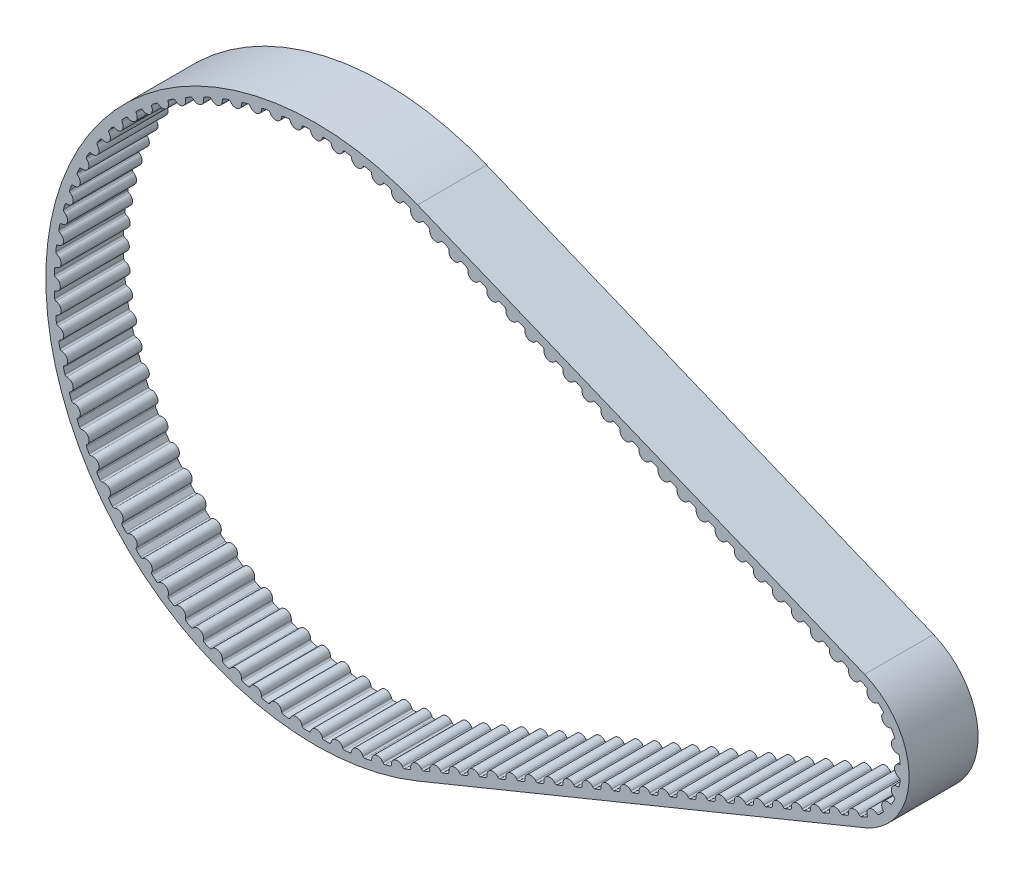
from build123d import *

# Parameters (mm, degrees)
BOSS_EXTRUDE1_DEPTH = 5
BOSS_EXTRUDE2_DEPTH = 10
CRVPATTERN1_START   = -5
CRVPATTERN1_DEPTH   = 10


# Read off the part's stored shape, not the designer's step: CrvPattern1
with BuildPart() as part:
    # Sketch1 → Boss-Extrude1 (new, symmetric)
    with BuildSketch(Plane.XY):
        with BuildLine():
            Line((14.796175155, 36.134164839), (79.540334051, 9.622803097))
            ThreePointArc((79.540334051, 9.622803097), (85.998296586, 0), (79.540334051, -9.622803097))
            Line((79.540334051, -9.622803097), (14.796175155, -36.134164839))
            ThreePointArc((14.796175155, -36.134164839), (-39.046186342, 0), (14.796175155, 36.134164839))
        make_face()
        with BuildLine():
            Line((14.330078536, 34.995896882), (79.074237432, 8.48453514))
            ThreePointArc((79.074237432, 8.48453514), (84.768296586, 0), (79.074237432, -8.48453514))
            Line((79.074237432, -8.48453514), (14.330078536, -34.995896882))
            ThreePointArc((14.330078536, -34.995896882), (-37.816186342, 0), (14.330078536, 34.995896882))
        make_face(mode=Mode.SUBTRACT)
    extrude(amount=BOSS_EXTRUDE1_DEPTH, both=True)

    # Sketch2 → Boss-Extrude2 (add)
    with BuildSketch(Plane.XY.offset(5)):
        with BuildLine():
            Line((-37.800086465, -1.103364278), (-38.300086465, -1.103364278))
            Line((-38.300086465, -1.103364278), (-38.300086465, 1.103364278))
            Line((-38.300086465, 1.103364278), (-37.800086465, 1.103364278))
            ThreePointArc((-37.800086465, 1.103364278), (-37.747580991, 0.938960056), (-37.603699093, 0.84365228))
            ThreePointArc((-37.603699093, 0.84365228), (-36.946186342, 0), (-37.603699093, -0.84365228))
            ThreePointArc((-37.603699093, -0.84365228), (-37.747580991, -0.938960056), (-37.800086465, -1.103364278))
        make_face()
    extrude(amount=-BOSS_EXTRUDE2_DEPTH)

    # CrvPattern1 outline → CrvPattern1 (add)
    with BuildSketch(Plane.XY.offset(CRVPATTERN1_START)):
        with BuildLine():
            ThreePointArc((-37.420700285, 3.800148005), (-37.556636037, 3.90648259), (-37.596041386, 4.074508753))
            ThreePointArc((-37.596041386, 4.074508753), (-37.698917327, 2.975832969), (-37.769693365, 1.874623321))
            ThreePointArc((-37.769693365, 1.874623321), (-37.704413408, 2.034385958), (-37.553477728, 2.118075822))
            ThreePointArc((-37.553477728, 2.118075822), (-36.83161522, 2.907370892), (-37.420700285, 3.800148005))
        make_face()
        with BuildLine():
            ThreePointArc((-37.005616272, 6.733075006), (-37.132762798, 6.849776907), (-37.158823627, 7.020382904))
            ThreePointArc((-37.158823627, 7.020382904), (-37.347837589, 5.933209661), (-37.505050586, 4.840984405))
            ThreePointArc((-37.505050586, 4.840984405), (-37.427401016, 4.995114601), (-37.270347665, 5.066667503))
            ThreePointArc((-37.270347665, 5.066667503), (-36.48861243, 5.796710112), (-37.005616272, 6.733075006))
        make_face()
        with BuildLine():
            ThreePointArc((-36.361021427, 9.624243113), (-36.478590157, 9.750588538), (-36.491144836, 9.92271626))
            ThreePointArc((-36.491144836, 9.92271626), (-36.765124545, 8.853788267), (-37.007799457, 7.777321443))
            ThreePointArc((-37.007799457, 7.777321443), (-36.91826186, 7.924863273), (-36.756064892, 7.983835439))
            ThreePointArc((-36.756064892, 7.983835439), (-35.919305295, 8.650097823), (-36.361021427, 9.624243113))
        make_face()
        with BuildLine():
            ThreePointArc((-35.490913562, 12.455721144), (-35.598175329, 12.590926492), (-35.597145994, 12.763508395))
            ThreePointArc((-35.597145994, 12.763508395), (-35.954392212, 11.719455199), (-36.281023956, 10.665423112))
            ThreePointArc((-36.281023956, 10.665423112), (-36.18015365, 10.805461515), (-36.013819019, 10.851487196))
            ThreePointArc((-36.013819019, 10.851487196), (-35.127224687, 11.449837159), (-35.490913562, 12.455721144))
        make_face()
        with BuildLine():
            ThreePointArc((-34.400689134, 15.209948119), (-34.496978694, 15.353174839), (-34.482371729, 15.525140561))
            ThreePointArc((-34.482371729, 15.525140561), (-34.920668796, 14.512437437), (-35.329231585, 13.487377251))
            ThreePointArc((-35.329231585, 13.487377251), (-35.217654172, 13.6190437), (-35.048213494, 13.651837443))
            ThreePointArc((-35.048213494, 13.651837443), (-34.117283134, 14.178563987), (-34.400689134, 15.209948119))
        make_face()
        with BuildLine():
            ThreePointArc((-33.097109773, 17.869842174), (-33.181829934, 18.020201967), (-33.153735931, 18.190484966))
            ThreePointArc((-33.153735931, 18.190484966), (-33.670365505, 17.215412754), (-34.15832541, 16.225681948))
            ThreePointArc((-34.15832541, 16.225681948), (-34.036732899, 16.348159841), (-33.865237055, 16.367518256))
            ThreePointArc((-33.865237055, 16.367518256), (-32.895744348, 16.819354596), (-33.097109773, 17.869842174))
        make_face()
        with BuildLine():
            ThreePointArc((-31.588260349, 20.418906503), (-31.660885671, 20.575466828), (-31.619478871, 20.743011001))
            ThreePointArc((-31.619478871, 20.743011001), (-32.211236787, 19.81161715), (-32.775567455, 18.863354088))
            ThreePointArc((-32.775567455, 18.863354088), (-32.644713971, 18.975883812), (-32.472226587, 18.981686837))
            ThreePointArc((-32.472226587, 18.981686837), (-31.470184378, 19.355830658), (-31.588260349, 20.418906503))
        make_face()
        with BuildLine():
            ThreePointArc((-29.883498828, 22.84133167), (-29.943578885, 23.003121532), (-29.889116095, 23.16688776))
            ThreePointArc((-29.889116095, 23.16688776), (-30.552332239, 22.284948827), (-31.18953366, 21.384034688))
            ThreePointArc((-31.18953366, 21.384034688), (-31.050230762, 21.485918325), (-30.877821614, 21.47812997))
            ThreePointArc((-30.877821614, 21.47812997), (-29.849444624, 21.772260813), (-29.883498828, 22.84133167))
        make_face()
        with BuildLine():
            ThreePointArc((-27.993398233, 25.122093664), (-28.040560405, 25.288109634), (-27.973379406, 25.44708223))
            ThreePointArc((-27.973379406, 25.44708223), (-28.703940476, 24.620068047), (-29.410060692, 23.772090349))
            ThreePointArc((-29.410060692, 23.772090349), (-29.263172345, 23.862696012), (-29.091910724, 23.841364581))
            ThreePointArc((-29.091910724, 23.841364581), (-28.043577001, 24.053658229), (-27.993398233, 25.122093664))
        make_face()
        with BuildLine():
            ThreePointArc((-25.929681069, 27.247047076), (-25.963632854, 27.416259514), (-25.884150307, 27.569452521))
            ThreePointArc((-25.884150307, 27.569452521), (-26.677525323, 26.802492274), (-27.448184939, 26.012710221))
            ThreePointArc((-27.448184939, 26.012710221), (-27.294622152, 26.09147597), (-27.125570231, 26.056733761))
            ThreePointArc((-27.125570231, 26.056733761), (-26.063781599, 26.185873558), (-25.929681069, 27.247047076))
        make_face()
        with BuildLine():
            ThreePointArc((-23.705146622, 29.203012829), (-23.725677449, 29.37437227), (-23.634386309, 29.520835578))
            ThreePointArc((-23.634386309, 29.520835578), (-24.485654717, 28.818685997), (-25.31607406, 28.091997858))
            ThreePointArc((-25.31607406, 28.091997858), (-25.156789237, 28.158435183), (-24.990995487, 28.11049767))
            ThreePointArc((-24.990995487, 28.11049767), (-23.922337215, 28.155682684), (-23.705146622, 29.203012829))
        make_face()
        with BuildLine():
            ThreePointArc((-21.333591575, 30.97785992), (-21.34057411, 31.150303583), (-21.23804057, 31.289128818))
            ThreePointArc((-21.23804057, 31.289128818), (-22.141922756, 30.656144671), (-23.026951521, 29.997057407))
            ThreePointArc((-23.026951521, 29.997057407), (-22.862932557, 30.05075426), (-22.701425238, 29.989918754))
            ThreePointArc((-22.701425238, 29.989918754), (-21.632525203, 29.950868745), (-21.333591575, 30.97785992))
        make_face()
        with BuildLine():
            ThreePointArc((-18.82972444, 32.560580649), (-18.823115379, 32.73303903), (-18.709975356, 32.86336519))
            ThreePointArc((-18.709975356, 32.86336519), (-19.660865395, 32.303472281), (-20.595014585, 31.716073586))
            ThreePointArc((-20.595014585, 31.716073586), (-20.427278733, 31.756696936), (-20.271059523, 31.683340741))
            ThreePointArc((-20.271059523, 31.683340741), (-19.208547101, 31.560297899), (-18.82972444, 32.560580649))
        make_face()
        with BuildLine():
            ThreePointArc((-16.209074337, 33.941358898), (-16.188914668, 34.1127624), (-16.065869864, 34.233781196))
            ThreePointArc((-16.065869864, 34.233781196), (-17.057870284, 33.750452009), (-18.035346256, 33.238384962))
            ThreePointArc((-18.035346256, 33.238384962), (-17.864933822, 33.265682861), (-17.714971601, 33.180260937))
            ThreePointArc((-17.714971601, 33.180260937), (-16.665436551, 32.973988381), (-16.209074337, 33.941358898))
        make_face()
        with BuildLine():
            ThreePointArc((-13.487894679, 35.111631005), (-13.454309434, 35.280916574), (-13.322122979, 35.391877441))
            ThreePointArc((-13.322122979, 35.391877441), (-14.34908134, 34.988109611), (-15.363821735, 34.554550079))
            ThreePointArc((-15.363821735, 34.554550079), (-15.191789627, 34.568353224), (-15.049014469, 34.471395362))
            ThreePointArc((-15.049014469, 34.471395362), (-14.018966065, 34.183172405), (-13.487894679, 35.111631005))
        make_face()
        with BuildLine():
            ThreePointArc((-10.68306237, 36.064138879), (-10.636259846, 36.230256598), (-10.495751567, 36.33047135))
            ThreePointArc((-10.495751567, 36.33047135), (-11.551298618, 36.008769066), (-12.597009961, 35.656406009))
            ThreePointArc((-12.597009961, 35.656406009), (-12.424425132, 35.656628792), (-12.289722536, 35.54873633))
            ThreePointArc((-12.289722536, 35.54873633), (-11.285549193, 35.180350547), (-10.68306237, 36.064138879))
        make_face()
        with BuildLine():
            ThreePointArc((-7.81197313, 36.792975016), (-7.7522436, 36.954894613), (-7.604284937, 37.043741712))
            ThreePointArc((-7.604284937, 37.043741712), (-8.681874118, 36.806100191), (-9.752070851, 36.537118983))
            ThreePointArc((-9.752070851, 36.537118983), (-9.580003681, 36.523760022), (-9.454209079, 36.405602115))
            ThreePointArc((-9.454209079, 36.405602115), (-8.482138735, 35.959338255), (-7.81197313, 36.792975016))
        make_face()
        with BuildLine():
            ThreePointArc((-4.892433611, 37.293619133), (-4.82014752, 37.450336375), (-4.665656121, 37.527264787))
            ThreePointArc((-4.665656121, 37.527264787), (-5.758604166, 37.375157893), (-6.846648871, 37.19122677))
            ThreePointArc((-6.846648871, 37.19122677), (-6.67616653, 37.164368919), (-6.560060107, 37.036678389))
            ThreePointArc((-6.560060107, 37.036678389), (-5.626121594, 36.515304203), (-4.892433611, 37.293619133))
        make_face()
        with BuildLine():
            ThreePointArc((-1.942550955, 37.56296621), (-1.858156624, 37.713509127), (-1.698090654, 37.778041738))
            ThreePointArc((-1.698090654, 37.778041738), (-2.79961904, 37.712412846), (-3.898763604, 37.61467256))
            ThreePointArc((-3.898763604, 37.61467256), (-3.730923432, 37.574482392), (-3.625225288, 37.438051182))
            ThreePointArc((-3.625225288, 37.438051182), (-2.735210944, 36.844800262), (-1.942550955, 37.56296621))
        make_face()
        with BuildLine():
            ThreePointArc((1.019379508, 37.59934574), (1.115358659, 37.742780657), (1.280006463, 37.794517233))
            ThreePointArc((1.280006463, 37.794517233), (0.176729475, 37.815773377), (-0.926697995, 37.804830118))
            ThreePointArc((-0.926697995, 37.804830118), (-0.762540947, 37.751556895), (-0.667906626, 37.607231159))
            ThreePointArc((-0.667906626, 37.607231159), (0.172663633, 36.945782878), (1.019379508, 37.59934574))
        make_face()
        with BuildLine():
            ThreePointArc((3.974987724, 37.402532097), (4.081956427, 37.537969423), (4.250164911, 37.576589091))
            ThreePointArc((4.250164911, 37.576589091), (3.151981904, 37.684598439), (2.051115045, 37.760520077))
            ThreePointArc((2.051115045, 37.760520077), (2.210570859, 37.694494202), (2.29355443, 37.543169056))
            ThreePointArc((2.29355443, 37.543169056), (3.079467341, 36.817625753), (3.974987724, 37.402532097))
        make_face()
        with BuildLine():
            ThreePointArc((6.905942851, 36.973745929), (7.023237682, 37.100345674), (7.193963607, 37.125608912))
            ThreePointArc((7.193963607, 37.125608912), (6.107685571, 37.319701585), (5.016206959, 37.482017251))
            ThreePointArc((5.016206959, 37.482017251), (5.169972585, 37.40364822), (5.240790736, 37.24626219))
            ThreePointArc((5.240790736, 37.24626219), (5.967172025, 36.461123724), (6.905942851, 36.973745929))
        make_face()
        with BuildLine():
            ThreePointArc((9.794066947, 36.315646591), (9.920960436, 36.432623577), (10.093144952, 36.444373701))
            ThreePointArc((10.093144952, 36.444373701), (9.025509043, 36.723345925), (7.950188086, 36.971048928))
            ThreePointArc((7.950188086, 36.971048928), (8.097309862, 36.88082279), (8.155523376, 36.718351994))
            ThreePointArc((8.155523376, 36.718351994), (8.817867987, 35.878487836), (9.794066947, 36.315646591))
        make_face()
        with BuildLine():
            ThreePointArc((12.621447711, 35.43231565), (12.757152858, 35.53894438), (12.929728066, 35.537108515))
            ThreePointArc((12.929728066, 35.537108515), (11.887355819, 35.89923009), (10.834861718, 36.230784162))
            ThreePointArc((10.834861718, 36.230784162), (10.974427185, 36.129260505), (11.019675019, 35.962712595))
            ThreePointArc((11.019675019, 35.962712595), (11.613875054, 35.073331627), (12.621447711, 35.43231565))
        make_face()
        with BuildLine():
            Line((15.691171558, 34.42122674), (15.697248702, 34.436069657))
            Line((15.697248702, 34.436069657), (14.330078536, 34.995896882))
            ThreePointArc((14.330078536, 34.995896882), (13.99190503, 35.132471348), (13.652430102, 35.265778054))
            Line((13.652430102, 35.265778054), (13.648983845, 35.25736086))
            ThreePointArc((13.648983845, 35.25736086), (13.781235119, 35.146477258), (13.814919283, 34.977211343))
            ThreePointArc((13.814919283, 34.977211343), (14.346533137, 34.049063242), (15.376412938, 34.337888074))
            ThreePointArc((15.376412938, 34.337888074), (15.519131413, 34.434929352), (15.691171558, 34.42122674))
        make_face()
        with BuildLine():
            Line((18.4478805, 33.292545771), (18.453911024, 33.307274824))
            Line((18.453911024, 33.307274824), (16.411757848, 34.143493295))
            Line((16.411757848, 34.143493295), (16.405692787, 34.128679891))
            ThreePointArc((16.405692787, 34.128679891), (16.537944061, 34.017796289), (16.571628225, 33.848530374))
            ThreePointArc((16.571628225, 33.848530374), (17.103242079, 32.920382273), (18.13312188, 33.209207105))
            ThreePointArc((18.13312188, 33.209207105), (18.275840355, 33.306248384), (18.4478805, 33.292545771))
        make_face()
        with BuildLine():
            Line((21.204589441, 32.163864802), (21.210573347, 32.178479991))
            Line((21.210573347, 32.178479991), (19.16842017, 33.014698462))
            Line((19.16842017, 33.014698462), (19.162401729, 32.999998922))
            ThreePointArc((19.162401729, 32.999998922), (19.294653003, 32.88911532), (19.328337167, 32.719849405))
            ThreePointArc((19.328337167, 32.719849405), (19.859951022, 31.791701304), (20.889830822, 32.080526137))
            ThreePointArc((20.889830822, 32.080526137), (21.032549297, 32.177567415), (21.204589441, 32.163864802))
        make_face()
        with BuildLine():
            Line((23.961298383, 31.035183833), (23.967235669, 31.049685158))
            Line((23.967235669, 31.049685158), (21.925082493, 31.885903629))
            Line((21.925082493, 31.885903629), (21.919110671, 31.871317953))
            ThreePointArc((21.919110671, 31.871317953), (22.051361945, 31.760434351), (22.085046109, 31.591168436))
            ThreePointArc((22.085046109, 31.591168436), (22.616659964, 30.663020336), (23.646539764, 30.951845168))
            ThreePointArc((23.646539764, 30.951845168), (23.789258239, 31.048886446), (23.961298383, 31.035183833))
        make_face()
        with BuildLine():
            Line((26.718007325, 29.906502864), (26.723897992, 29.920890325))
            Line((26.723897992, 29.920890325), (24.681744815, 30.757108796))
            Line((24.681744815, 30.757108796), (24.675819613, 30.742636985))
            ThreePointArc((24.675819613, 30.742636985), (24.808070887, 30.631753382), (24.841755051, 30.462487468))
            ThreePointArc((24.841755051, 30.462487468), (25.373368905, 29.534339367), (26.403248706, 29.823164199))
            ThreePointArc((26.403248706, 29.823164199), (26.545967181, 29.920205477), (26.718007325, 29.906502864))
        make_face()
        with BuildLine():
            Line((29.474716267, 28.777821896), (29.480560314, 28.792095492))
            Line((29.480560314, 28.792095492), (27.438407138, 29.628313963))
            Line((27.438407138, 29.628313963), (27.432528555, 29.613956016))
            ThreePointArc((27.432528555, 29.613956016), (27.564779829, 29.503072414), (27.598463993, 29.333806499))
            ThreePointArc((27.598463993, 29.333806499), (28.130077847, 28.405658398), (29.159957648, 28.69448323))
            ThreePointArc((29.159957648, 28.69448323), (29.302676123, 28.791524508), (29.474716267, 28.777821896))
        make_face()
        with BuildLine():
            Line((32.231425209, 27.649140927), (32.237222637, 27.663300659))
            Line((32.237222637, 27.663300659), (30.19506946, 28.49951913))
            Line((30.19506946, 28.49951913), (30.189237497, 28.485275047))
            ThreePointArc((30.189237497, 28.485275047), (30.321488771, 28.374391445), (30.355172935, 28.20512553))
            ThreePointArc((30.355172935, 28.20512553), (30.886786789, 27.276977429), (31.91666659, 27.565802261))
            ThreePointArc((31.91666659, 27.565802261), (32.059385065, 27.662843539), (32.231425209, 27.649140927))
        make_face()
        with BuildLine():
            Line((34.988134151, 26.520459958), (34.993884959, 26.534505826))
            Line((34.993884959, 26.534505826), (32.951731783, 27.370724297))
            Line((32.951731783, 27.370724297), (32.945946439, 27.356594078))
            ThreePointArc((32.945946439, 27.356594078), (33.078197713, 27.245710476), (33.111881877, 27.076444561))
            ThreePointArc((33.111881877, 27.076444561), (33.643495731, 26.14829646), (34.673375532, 26.437121292))
            ThreePointArc((34.673375532, 26.437121292), (34.816094007, 26.534162571), (34.988134151, 26.520459958))
        make_face()
        with BuildLine():
            Line((37.744843093, 25.391778989), (37.750547282, 25.405710993))
            Line((37.750547282, 25.405710993), (35.708394105, 26.241929464))
            Line((35.708394105, 26.241929464), (35.702655381, 26.227913109))
            ThreePointArc((35.702655381, 26.227913109), (35.834906655, 26.117029507), (35.868590819, 25.947763592))
            ThreePointArc((35.868590819, 25.947763592), (36.400204673, 25.019615491), (37.430084474, 25.308440324))
            ThreePointArc((37.430084474, 25.308440324), (37.572802949, 25.405481602), (37.744843093, 25.391778989))
        make_face()
        with BuildLine():
            Line((40.501552035, 24.26309802), (40.507209604, 24.27691616))
            Line((40.507209604, 24.27691616), (38.465056428, 25.113134631))
            Line((38.465056428, 25.113134631), (38.459364323, 25.099232141))
            ThreePointArc((38.459364323, 25.099232141), (38.591615597, 24.988348538), (38.625299761, 24.819082623))
            ThreePointArc((38.625299761, 24.819082623), (39.156913616, 23.890934523), (40.186793416, 24.179759355))
            ThreePointArc((40.186793416, 24.179759355), (40.329511891, 24.276800633), (40.501552035, 24.26309802))
        make_face()
        with BuildLine():
            Line((43.258260977, 23.134417051), (43.263871927, 23.148121327))
            Line((43.263871927, 23.148121327), (41.22171875, 23.984339798))
            Line((41.22171875, 23.984339798), (41.216073264, 23.970551172))
            ThreePointArc((41.216073264, 23.970551172), (41.348324539, 23.85966757), (41.382008703, 23.690401655))
            ThreePointArc((41.382008703, 23.690401655), (41.913622557, 22.762253554), (42.943502358, 23.051078386))
            ThreePointArc((42.943502358, 23.051078386), (43.086220833, 23.148119664), (43.258260977, 23.134417051))
        make_face()
        with BuildLine():
            Line((46.014969919, 22.005736083), (46.020534249, 22.019326494))
            Line((46.020534249, 22.019326494), (43.978381072, 22.855544965))
            Line((43.978381072, 22.855544965), (43.972782206, 22.841870203))
            ThreePointArc((43.972782206, 22.841870203), (44.105033481, 22.730986601), (44.138717645, 22.561720686))
            ThreePointArc((44.138717645, 22.561720686), (44.670331499, 21.633572585), (45.7002113, 21.922397417))
            ThreePointArc((45.7002113, 21.922397417), (45.842929775, 22.019438695), (46.014969919, 22.005736083))
        make_face()
        with BuildLine():
            Line((48.771678861, 20.877055114), (48.777196572, 20.89053166))
            Line((48.777196572, 20.89053166), (46.735043395, 21.726750132))
            Line((46.735043395, 21.726750132), (46.729491148, 21.713189234))
            ThreePointArc((46.729491148, 21.713189234), (46.861742423, 21.602305632), (46.895426587, 21.433039717))
            ThreePointArc((46.895426587, 21.433039717), (47.427040441, 20.504891616), (48.456920242, 20.793716448))
            ThreePointArc((48.456920242, 20.793716448), (48.599638717, 20.890757726), (48.771678861, 20.877055114))
        make_face()
        with BuildLine():
            Line((51.528387803, 19.748374145), (51.533858894, 19.761736827))
            Line((51.533858894, 19.761736827), (49.491705717, 20.597955299))
            Line((49.491705717, 20.597955299), (49.48620009, 20.584508265))
            ThreePointArc((49.48620009, 20.584508265), (49.618451365, 20.473624663), (49.652135529, 20.304358748))
            ThreePointArc((49.652135529, 20.304358748), (50.183749383, 19.376210647), (51.213629184, 19.665035479))
            ThreePointArc((51.213629184, 19.665035479), (51.356347659, 19.762076758), (51.528387803, 19.748374145))
        make_face()
        with BuildLine():
            Line((54.285096745, 18.619693176), (54.290521217, 18.632941994))
            Line((54.290521217, 18.632941994), (52.24836804, 19.469160466))
            Line((52.24836804, 19.469160466), (52.242909032, 19.455827296))
            ThreePointArc((52.242909032, 19.455827296), (52.375160307, 19.344943694), (52.408844471, 19.175677779))
            ThreePointArc((52.408844471, 19.175677779), (52.940458325, 18.247529678), (53.970338126, 18.536354511))
            ThreePointArc((53.970338126, 18.536354511), (54.113056601, 18.633395789), (54.285096745, 18.619693176))
        make_face()
        with BuildLine():
            Line((57.041805687, 17.491012207), (57.047183539, 17.504147161))
            Line((57.047183539, 17.504147161), (55.005030362, 18.340365633))
            Line((55.005030362, 18.340365633), (54.999617974, 18.327146328))
            ThreePointArc((54.999617974, 18.327146328), (55.131869249, 18.216262725), (55.165553413, 18.04699681))
            ThreePointArc((55.165553413, 18.04699681), (55.697167268, 17.11884871), (56.727047068, 17.407673542))
            ThreePointArc((56.727047068, 17.407673542), (56.869765543, 17.50471482), (57.041805687, 17.491012207))
        make_face()
        with BuildLine():
            Line((59.798514629, 16.362331238), (59.803845861, 16.375352328))
            Line((59.803845861, 16.375352328), (57.761692685, 17.2115708))
            Line((57.761692685, 17.2115708), (57.756326916, 17.198465359))
            ThreePointArc((57.756326916, 17.198465359), (57.888578191, 17.087581757), (57.922262355, 16.918315842))
            ThreePointArc((57.922262355, 16.918315842), (58.453876209, 15.990167741), (59.48375601, 16.278992573))
            ThreePointArc((59.48375601, 16.278992573), (59.626474485, 16.376033851), (59.798514629, 16.362331238))
        make_face()
        with BuildLine():
            Line((62.555223571, 15.23365027), (62.560508184, 15.246557495))
            Line((62.560508184, 15.246557495), (60.518355007, 16.082775967))
            Line((60.518355007, 16.082775967), (60.513035858, 16.06978439))
            ThreePointArc((60.513035858, 16.06978439), (60.645287133, 15.958900788), (60.678971296, 15.789634873))
            ThreePointArc((60.678971296, 15.789634873), (61.210585151, 14.861486772), (62.240464952, 15.150311604))
            ThreePointArc((62.240464952, 15.150311604), (62.383183427, 15.247352882), (62.555223571, 15.23365027))
        make_face()
        with BuildLine():
            Line((65.311932513, 14.104969301), (65.317170506, 14.117762662))
            Line((65.317170506, 14.117762662), (63.27501733, 14.953981133))
            Line((63.27501733, 14.953981133), (63.2697448, 14.941103421))
            ThreePointArc((63.2697448, 14.941103421), (63.401996074, 14.830219819), (63.435680238, 14.660953904))
            ThreePointArc((63.435680238, 14.660953904), (63.967294093, 13.732805803), (64.997173894, 14.021630635))
            ThreePointArc((64.997173894, 14.021630635), (65.139892369, 14.118671914), (65.311932513, 14.104969301))
        make_face()
        with BuildLine():
            Line((68.068641455, 12.976288332), (68.073832829, 12.988967829))
            Line((68.073832829, 12.988967829), (66.031679652, 13.825186301))
            Line((66.031679652, 13.825186301), (66.026453742, 13.812422452))
            ThreePointArc((66.026453742, 13.812422452), (66.158705016, 13.70153885), (66.19238918, 13.532272935))
            ThreePointArc((66.19238918, 13.532272935), (66.724003035, 12.604124834), (67.753882836, 12.892949667))
            ThreePointArc((67.753882836, 12.892949667), (67.896601311, 12.989990945), (68.068641455, 12.976288332))
        make_face()
        with BuildLine():
            Line((70.825350397, 11.847607363), (70.830495151, 11.860172996))
            Line((70.830495151, 11.860172996), (68.788341975, 12.696391467))
            Line((68.788341975, 12.696391467), (68.783162684, 12.683741483))
            ThreePointArc((68.783162684, 12.683741483), (68.915413958, 12.572857881), (68.949098122, 12.403591966))
            ThreePointArc((68.949098122, 12.403591966), (69.480711977, 11.475443865), (70.510591777, 11.764268698))
            ThreePointArc((70.510591777, 11.764268698), (70.653310253, 11.861309976), (70.825350397, 11.847607363))
        make_face()
        with BuildLine():
            Line((73.582059339, 10.718926394), (73.587157474, 10.731378163))
            Line((73.587157474, 10.731378163), (71.545004297, 11.567596635))
            Line((71.545004297, 11.567596635), (71.539871626, 11.555060515))
            ThreePointArc((71.539871626, 11.555060515), (71.6721229, 11.444176912), (71.705807064, 11.274910998))
            ThreePointArc((71.705807064, 11.274910998), (72.237420918, 10.346762897), (73.267300719, 10.635587729))
            ThreePointArc((73.267300719, 10.635587729), (73.410019195, 10.732629007), (73.582059339, 10.718926394))
        make_face()
        with BuildLine():
            Line((76.338768281, 9.590245426), (76.343819796, 9.60258333))
            Line((76.343819796, 9.60258333), (74.30166662, 10.438801801))
            Line((74.30166662, 10.438801801), (74.296580568, 10.426379546))
            ThreePointArc((74.296580568, 10.426379546), (74.428831842, 10.315495943), (74.462516006, 10.146230029))
            ThreePointArc((74.462516006, 10.146230029), (74.99412986, 9.218081928), (76.024009661, 9.50690676))
            ThreePointArc((76.024009661, 9.50690676), (76.166728137, 9.603948038), (76.338768281, 9.590245426))
        make_face()
        with BuildLine():
            Line((79.095477223, 8.461564457), (79.100465499, 8.473747906))
            ThreePointArc((79.100465499, 8.473747906), (79.087355636, 8.479151664), (79.074237432, 8.48453514))
            Line((79.074237432, 8.48453514), (77.058328942, 9.310006968))
            Line((77.058328942, 9.310006968), (77.05328951, 9.297698577))
            ThreePointArc((77.05328951, 9.297698577), (77.185540784, 9.186814975), (77.219224948, 9.01754906))
            ThreePointArc((77.219224948, 9.01754906), (77.750838802, 8.089400959), (78.780718603, 8.378225791))
            ThreePointArc((78.780718603, 8.378225791), (78.923437079, 8.475267069), (79.095477223, 8.461564457))
        make_face()
        with BuildLine():
            ThreePointArc((81.328876625, 6.939020913), (81.415758408, 6.99023217), (81.5155913, 7.004530095))
            ThreePointArc((81.5155913, 7.004530095), (80.748506297, 7.586207563), (79.924657031, 8.084244173))
            ThreePointArc((79.924657031, 8.084244173), (79.948239282, 7.986188503), (79.93273477, 7.88653587))
            ThreePointArc((79.93273477, 7.88653587), (80.261575873, 6.868726597), (81.328876625, 6.939020913))
        make_face()
        with BuildLine():
            ThreePointArc((83.243923843, 4.747680159), (83.342606388, 4.768483824), (83.441781412, 4.750171215))
            ThreePointArc((83.441781412, 4.750171215), (82.900463274, 5.54625083), (82.278654719, 6.281180894))
            ThreePointArc((82.278654719, 6.281180894), (82.269708091, 6.18072695), (82.223209229, 6.091234532))
            ThreePointArc((82.223209229, 6.091234532), (82.210007154, 5.021702909), (83.243923843, 4.747680159))
        make_face()
        with BuildLine():
            ThreePointArc((84.359424736, 2.059737097), (84.459585953, 2.047957128), (84.547729506, 1.998949465))
            ThreePointArc((84.547729506, 1.998949465), (84.288799538, 2.926162143), (83.934072209, 3.821112756))
            ThreePointArc((83.934072209, 3.821112756), (83.893532509, 3.728767914), (83.820903029, 3.658796523))
            ThreePointArc((83.820903029, 3.658796523), (83.467038699, 2.649414423), (84.359424736, 2.059737097))
        make_face()
        with BuildLine():
            ThreePointArc((84.558699093, -0.84365228), (84.649862225, -0.886783711), (84.717754586, -0.961360278))
            ThreePointArc((84.717754586, -0.961360278), (84.768296586, 0), (84.717754587, 0.961360278))
            ThreePointArc((84.717754587, 0.961360278), (84.649862225, 0.886783711), (84.558699093, 0.84365228))
            ThreePointArc((84.558699093, 0.84365228), (83.901186342, 0), (84.558699093, -0.84365228))
        make_face()
        with BuildLine():
            ThreePointArc((83.820903029, -3.658796523), (83.893532509, -3.728767914), (83.934072209, -3.821112756))
            ThreePointArc((83.934072209, -3.821112756), (84.288799538, -2.926162143), (84.547729507, -1.998949465))
            ThreePointArc((84.547729507, -1.998949465), (84.459585953, -2.047957128), (84.359424736, -2.059737097))
            ThreePointArc((84.359424736, -2.059737097), (83.467038699, -2.649414423), (83.820903029, -3.658796523))
        make_face()
        with BuildLine():
            ThreePointArc((82.223209229, -6.091234532), (82.269708091, -6.18072695), (82.278654719, -6.281180894))
            ThreePointArc((82.278654719, -6.281180894), (82.900463274, -5.54625083), (83.441781412, -4.750171215))
            ThreePointArc((83.441781412, -4.750171215), (83.342606388, -4.768483824), (83.243923843, -4.747680159))
            ThreePointArc((83.243923843, -4.747680159), (82.210007154, -5.021702909), (82.223209229, -6.091234532))
        make_face()
        with BuildLine():
            ThreePointArc((79.93273477, -7.88653587), (79.948239282, -7.986188503), (79.924657031, -8.084244173))
            ThreePointArc((79.924657031, -8.084244173), (80.748506297, -7.586207563), (81.5155913, -7.004530095))
            ThreePointArc((81.5155913, -7.004530095), (81.415758408, -6.99023217), (81.328876625, -6.939020913))
            ThreePointArc((81.328876625, -6.939020913), (80.261575873, -6.868726597), (79.93273477, -7.88653587))
        make_face()
        with BuildLine():
            Line((77.05328951, -9.297698577), (77.058328942, -9.310006969))
            Line((77.058328942, -9.310006969), (79.074237432, -8.48453514))
            ThreePointArc((79.074237432, -8.48453514), (79.087355636, -8.479151664), (79.100465499, -8.473747906))
            Line((79.100465499, -8.473747906), (79.095477223, -8.461564457))
            ThreePointArc((79.095477223, -8.461564457), (78.923437079, -8.475267069), (78.780718603, -8.378225791))
            ThreePointArc((78.780718603, -8.378225791), (77.750838802, -8.089400959), (77.219224948, -9.01754906))
            ThreePointArc((77.219224948, -9.01754906), (77.185540784, -9.186814975), (77.05328951, -9.297698577))
        make_face()
        with BuildLine():
            Line((74.296580568, -10.426379546), (74.30166662, -10.438801802))
            Line((74.30166662, -10.438801802), (76.343819796, -9.60258333))
            Line((76.343819796, -9.60258333), (76.338768281, -9.590245426))
            ThreePointArc((76.338768281, -9.590245426), (76.166728137, -9.603948038), (76.024009661, -9.50690676))
            ThreePointArc((76.024009661, -9.50690676), (74.99412986, -9.218081928), (74.462516006, -10.146230029))
            ThreePointArc((74.462516006, -10.146230029), (74.428831842, -10.315495943), (74.296580568, -10.426379546))
        make_face()
        with BuildLine():
            Line((71.539871626, -11.555060515), (71.545004297, -11.567596635))
            Line((71.545004297, -11.567596635), (73.587157474, -10.731378163))
            Line((73.587157474, -10.731378163), (73.582059339, -10.718926394))
            ThreePointArc((73.582059339, -10.718926394), (73.410019195, -10.732629007), (73.267300719, -10.635587729))
            ThreePointArc((73.267300719, -10.635587729), (72.237420918, -10.346762897), (71.705807064, -11.274910998))
            ThreePointArc((71.705807064, -11.274910998), (71.6721229, -11.444176912), (71.539871626, -11.555060515))
        make_face()
        with BuildLine():
            Line((68.783162684, -12.683741483), (68.788341975, -12.696391468))
            Line((68.788341975, -12.696391468), (70.830495151, -11.860172996))
            Line((70.830495151, -11.860172996), (70.825350397, -11.847607363))
            ThreePointArc((70.825350397, -11.847607363), (70.653310253, -11.861309976), (70.510591777, -11.764268698))
            ThreePointArc((70.510591777, -11.764268698), (69.480711977, -11.475443865), (68.949098122, -12.403591966))
            ThreePointArc((68.949098122, -12.403591966), (68.915413958, -12.572857881), (68.783162684, -12.683741483))
        make_face()
        with BuildLine():
            Line((66.026453742, -13.812422452), (66.031679652, -13.825186301))
            Line((66.031679652, -13.825186301), (68.073832829, -12.988967829))
            Line((68.073832829, -12.988967829), (68.068641455, -12.976288332))
            ThreePointArc((68.068641455, -12.976288332), (67.896601311, -12.989990945), (67.753882836, -12.892949667))
            ThreePointArc((67.753882836, -12.892949667), (66.724003035, -12.604124834), (66.19238918, -13.532272935))
            ThreePointArc((66.19238918, -13.532272935), (66.158705016, -13.70153885), (66.026453742, -13.812422452))
        make_face()
        with BuildLine():
            Line((63.2697448, -14.941103421), (63.27501733, -14.953981134))
            Line((63.27501733, -14.953981134), (65.317170506, -14.117762662))
            Line((65.317170506, -14.117762662), (65.311932513, -14.104969301))
            ThreePointArc((65.311932513, -14.104969301), (65.139892369, -14.118671914), (64.997173894, -14.021630635))
            ThreePointArc((64.997173894, -14.021630635), (63.967294093, -13.732805803), (63.435680238, -14.660953904))
            ThreePointArc((63.435680238, -14.660953904), (63.401996074, -14.830219819), (63.2697448, -14.941103421))
        make_face()
        with BuildLine():
            Line((60.513035858, -16.06978439), (60.518355007, -16.082775967))
            Line((60.518355007, -16.082775967), (62.560508184, -15.246557495))
            Line((62.560508184, -15.246557495), (62.555223571, -15.23365027))
            ThreePointArc((62.555223571, -15.23365027), (62.383183427, -15.247352882), (62.240464952, -15.150311604))
            ThreePointArc((62.240464952, -15.150311604), (61.210585151, -14.861486772), (60.678971296, -15.789634873))
            ThreePointArc((60.678971296, -15.789634873), (60.645287133, -15.958900788), (60.513035858, -16.06978439))
        make_face()
        with BuildLine():
            Line((57.756326916, -17.198465359), (57.761692685, -17.2115708))
            Line((57.761692685, -17.2115708), (59.803845861, -16.375352328))
            Line((59.803845861, -16.375352328), (59.798514629, -16.362331238))
            ThreePointArc((59.798514629, -16.362331238), (59.626474485, -16.376033851), (59.48375601, -16.278992573))
            ThreePointArc((59.48375601, -16.278992573), (58.453876209, -15.990167741), (57.922262355, -16.918315842))
            ThreePointArc((57.922262355, -16.918315842), (57.888578191, -17.087581757), (57.756326916, -17.198465359))
        make_face()
        with BuildLine():
            Line((54.999617974, -18.327146328), (55.005030362, -18.340365633))
            Line((55.005030362, -18.340365633), (57.047183539, -17.504147161))
            Line((57.047183539, -17.504147161), (57.041805687, -17.491012207))
            ThreePointArc((57.041805687, -17.491012207), (56.869765543, -17.50471482), (56.727047068, -17.407673542))
            ThreePointArc((56.727047068, -17.407673542), (55.697167268, -17.11884871), (55.165553413, -18.04699681))
            ThreePointArc((55.165553413, -18.04699681), (55.131869249, -18.216262725), (54.999617974, -18.327146328))
        make_face()
        with BuildLine():
            Line((52.242909032, -19.455827296), (52.24836804, -19.469160466))
            Line((52.24836804, -19.469160466), (54.290521217, -18.632941994))
            Line((54.290521217, -18.632941994), (54.285096745, -18.619693176))
            ThreePointArc((54.285096745, -18.619693176), (54.113056601, -18.633395789), (53.970338126, -18.536354511))
            ThreePointArc((53.970338126, -18.536354511), (52.940458325, -18.247529678), (52.408844471, -19.175677779))
            ThreePointArc((52.408844471, -19.175677779), (52.375160307, -19.344943694), (52.242909032, -19.455827296))
        make_face()
        with BuildLine():
            Line((49.48620009, -20.584508265), (49.491705717, -20.597955299))
            Line((49.491705717, -20.597955299), (51.533858894, -19.761736827))
            Line((51.533858894, -19.761736827), (51.528387803, -19.748374145))
            ThreePointArc((51.528387803, -19.748374145), (51.356347659, -19.762076758), (51.213629184, -19.665035479))
            ThreePointArc((51.213629184, -19.665035479), (50.183749383, -19.376210647), (49.652135529, -20.304358748))
            ThreePointArc((49.652135529, -20.304358748), (49.618451365, -20.473624663), (49.48620009, -20.584508265))
        make_face()
        with BuildLine():
            Line((46.729491148, -21.713189234), (46.735043395, -21.726750132))
            Line((46.735043395, -21.726750132), (48.777196572, -20.89053166))
            Line((48.777196572, -20.89053166), (48.771678861, -20.877055114))
            ThreePointArc((48.771678861, -20.877055114), (48.599638717, -20.890757726), (48.456920242, -20.793716448))
            ThreePointArc((48.456920242, -20.793716448), (47.427040441, -20.504891616), (46.895426587, -21.433039717))
            ThreePointArc((46.895426587, -21.433039717), (46.861742423, -21.602305632), (46.729491148, -21.713189234))
        make_face()
        with BuildLine():
            Line((43.972782206, -22.841870203), (43.978381072, -22.855544965))
            Line((43.978381072, -22.855544965), (46.020534249, -22.019326493))
            Line((46.020534249, -22.019326493), (46.014969919, -22.005736083))
            ThreePointArc((46.014969919, -22.005736083), (45.842929775, -22.019438695), (45.7002113, -21.922397417))
            ThreePointArc((45.7002113, -21.922397417), (44.670331499, -21.633572585), (44.138717645, -22.561720686))
            ThreePointArc((44.138717645, -22.561720686), (44.105033481, -22.730986601), (43.972782206, -22.841870203))
        make_face()
        with BuildLine():
            Line((41.216073264, -23.970551172), (41.22171875, -23.984339798))
            Line((41.22171875, -23.984339798), (43.263871927, -23.148121326))
            Line((43.263871927, -23.148121326), (43.258260977, -23.134417051))
            ThreePointArc((43.258260977, -23.134417051), (43.086220833, -23.148119664), (42.943502358, -23.051078386))
            ThreePointArc((42.943502358, -23.051078386), (41.913622557, -22.762253554), (41.382008703, -23.690401655))
            ThreePointArc((41.382008703, -23.690401655), (41.348324539, -23.85966757), (41.216073264, -23.970551172))
        make_face()
        with BuildLine():
            Line((38.459364323, -25.099232141), (38.465056428, -25.113134631))
            Line((38.465056428, -25.113134631), (40.507209604, -24.276916159))
            Line((40.507209604, -24.276916159), (40.501552035, -24.26309802))
            ThreePointArc((40.501552035, -24.26309802), (40.329511891, -24.276800633), (40.186793416, -24.179759355))
            ThreePointArc((40.186793416, -24.179759355), (39.156913616, -23.890934523), (38.625299761, -24.819082623))
            ThreePointArc((38.625299761, -24.819082623), (38.591615597, -24.988348538), (38.459364323, -25.099232141))
        make_face()
        with BuildLine():
            Line((35.702655381, -26.227913109), (35.708394105, -26.241929464))
            Line((35.708394105, -26.241929464), (37.750547282, -25.405710992))
            Line((37.750547282, -25.405710992), (37.744843093, -25.391778989))
            ThreePointArc((37.744843093, -25.391778989), (37.572802949, -25.405481602), (37.430084474, -25.308440324))
            ThreePointArc((37.430084474, -25.308440324), (36.400204673, -25.019615491), (35.868590819, -25.947763592))
            ThreePointArc((35.868590819, -25.947763592), (35.834906655, -26.117029507), (35.702655381, -26.227913109))
        make_face()
        with BuildLine():
            Line((32.945946439, -27.356594078), (32.951731783, -27.370724297))
            Line((32.951731783, -27.370724297), (34.993884959, -26.534505826))
            Line((34.993884959, -26.534505826), (34.988134151, -26.520459958))
            ThreePointArc((34.988134151, -26.520459958), (34.816094007, -26.534162571), (34.673375532, -26.437121292))
            ThreePointArc((34.673375532, -26.437121292), (33.643495731, -26.14829646), (33.111881877, -27.076444561))
            ThreePointArc((33.111881877, -27.076444561), (33.078197713, -27.245710476), (32.945946439, -27.356594078))
        make_face()
        with BuildLine():
            Line((30.189237497, -28.485275047), (30.19506946, -28.49951913))
            Line((30.19506946, -28.49951913), (32.237222637, -27.663300658))
            Line((32.237222637, -27.663300658), (32.231425209, -27.649140927))
            ThreePointArc((32.231425209, -27.649140927), (32.059385065, -27.662843539), (31.91666659, -27.565802261))
            ThreePointArc((31.91666659, -27.565802261), (30.886786789, -27.276977429), (30.355172935, -28.20512553))
            ThreePointArc((30.355172935, -28.20512553), (30.321488771, -28.374391445), (30.189237497, -28.485275047))
        make_face()
        with BuildLine():
            Line((27.432528555, -29.613956016), (27.438407138, -29.628313963))
            Line((27.438407138, -29.628313963), (29.480560314, -28.792095492))
            Line((29.480560314, -28.792095492), (29.474716267, -28.777821896))
            ThreePointArc((29.474716267, -28.777821896), (29.302676123, -28.791524508), (29.159957648, -28.69448323))
            ThreePointArc((29.159957648, -28.69448323), (28.130077847, -28.405658398), (27.598463993, -29.333806499))
            ThreePointArc((27.598463993, -29.333806499), (27.564779829, -29.503072414), (27.432528555, -29.613956016))
        make_face()
        with BuildLine():
            Line((24.675819613, -30.742636985), (24.681744815, -30.757108797))
            Line((24.681744815, -30.757108797), (26.723897992, -29.920890324))
            Line((26.723897992, -29.920890324), (26.718007325, -29.906502864))
            ThreePointArc((26.718007325, -29.906502864), (26.545967181, -29.920205477), (26.403248706, -29.823164199))
            ThreePointArc((26.403248706, -29.823164199), (25.373368905, -29.534339367), (24.841755051, -30.462487468))
            ThreePointArc((24.841755051, -30.462487468), (24.808070887, -30.631753382), (24.675819613, -30.742636985))
        make_face()
        with BuildLine():
            Line((21.919110671, -31.871317953), (21.925082493, -31.88590363))
            Line((21.925082493, -31.88590363), (23.967235669, -31.049685158))
            Line((23.967235669, -31.049685158), (23.961298383, -31.035183833))
            ThreePointArc((23.961298383, -31.035183833), (23.789258239, -31.048886446), (23.646539764, -30.951845168))
            ThreePointArc((23.646539764, -30.951845168), (22.616659964, -30.663020336), (22.085046109, -31.591168436))
            ThreePointArc((22.085046109, -31.591168436), (22.051361945, -31.760434351), (21.919110671, -31.871317953))
        make_face()
        with BuildLine():
            Line((19.162401729, -32.999998922), (19.16842017, -33.014698463))
            Line((19.16842017, -33.014698463), (21.210573347, -32.178479991))
            Line((21.210573347, -32.178479991), (21.204589441, -32.163864802))
            ThreePointArc((21.204589441, -32.163864802), (21.032549297, -32.177567415), (20.889830822, -32.080526137))
            ThreePointArc((20.889830822, -32.080526137), (19.859951022, -31.791701304), (19.328337167, -32.719849405))
            ThreePointArc((19.328337167, -32.719849405), (19.294653003, -32.88911532), (19.162401729, -32.999998922))
        make_face()
        with BuildLine():
            Line((16.405692787, -34.128679891), (16.411757848, -34.143493296))
            Line((16.411757848, -34.143493296), (18.453911024, -33.307274824))
            Line((18.453911024, -33.307274824), (18.4478805, -33.292545771))
            ThreePointArc((18.4478805, -33.292545771), (18.275840355, -33.306248384), (18.13312188, -33.209207105))
            ThreePointArc((18.13312188, -33.209207105), (17.103242079, -32.920382273), (16.571628225, -33.848530374))
            ThreePointArc((16.571628225, -33.848530374), (16.537944061, -34.017796289), (16.405692787, -34.128679891))
        make_face()
        with BuildLine():
            Line((13.648983845, -35.25736086), (13.652430102, -35.265778054))
            ThreePointArc((13.652430102, -35.265778054), (13.99190503, -35.132471348), (14.330078536, -34.995896882))
            Line((14.330078536, -34.995896882), (15.697248702, -34.436069657))
            Line((15.697248702, -34.436069657), (15.691171558, -34.42122674))
            ThreePointArc((15.691171558, -34.42122674), (15.519131413, -34.434929352), (15.376412938, -34.337888074))
            ThreePointArc((15.376412938, -34.337888074), (14.346533137, -34.049063242), (13.814919283, -34.977211343))
            ThreePointArc((13.814919283, -34.977211343), (13.781235119, -35.146477258), (13.648983845, -35.25736086))
        make_face()
        with BuildLine():
            ThreePointArc((11.019675019, -35.962712595), (10.974427185, -36.129260505), (10.834861718, -36.230784162))
            ThreePointArc((10.834861718, -36.230784162), (11.887355819, -35.89923009), (12.929728066, -35.537108514))
            ThreePointArc((12.929728066, -35.537108514), (12.757152858, -35.53894438), (12.621447711, -35.43231565))
            ThreePointArc((12.621447711, -35.43231565), (11.613875054, -35.073331627), (11.019675019, -35.962712595))
        make_face()
        with BuildLine():
            ThreePointArc((8.155523376, -36.718351994), (8.097309862, -36.88082279), (7.950188086, -36.971048928))
            ThreePointArc((7.950188086, -36.971048928), (9.025509043, -36.723345925), (10.093144952, -36.4443737))
            ThreePointArc((10.093144952, -36.4443737), (9.920960436, -36.432623577), (9.794066947, -36.315646591))
            ThreePointArc((9.794066947, -36.315646591), (8.817867987, -35.878487836), (8.155523376, -36.718351994))
        make_face()
        with BuildLine():
            ThreePointArc((5.240790736, -37.24626219), (5.169972585, -37.40364822), (5.016206959, -37.482017251))
            ThreePointArc((5.016206959, -37.482017251), (6.107685571, -37.319701585), (7.193963607, -37.125608912))
            ThreePointArc((7.193963607, -37.125608912), (7.023237682, -37.100345674), (6.905942851, -36.973745929))
            ThreePointArc((6.905942851, -36.973745929), (5.967172025, -36.461123724), (5.240790736, -37.24626219))
        make_face()
        with BuildLine():
            ThreePointArc((2.29355443, -37.543169056), (2.210570859, -37.694494202), (2.051115045, -37.760520078))
            ThreePointArc((2.051115045, -37.760520078), (3.151981904, -37.684598439), (4.250164911, -37.57658909))
            ThreePointArc((4.250164911, -37.57658909), (4.081956427, -37.537969423), (3.974987724, -37.402532097))
            ThreePointArc((3.974987724, -37.402532097), (3.079467341, -36.817625753), (2.29355443, -37.543169056))
        make_face()
        with BuildLine():
            ThreePointArc((-0.667906626, -37.607231159), (-0.762540947, -37.751556895), (-0.926697995, -37.804830118))
            ThreePointArc((-0.926697995, -37.804830118), (0.176729475, -37.815773377), (1.280006463, -37.794517233))
            ThreePointArc((1.280006463, -37.794517233), (1.115358659, -37.742780657), (1.019379508, -37.59934574))
            ThreePointArc((1.019379508, -37.59934574), (0.172663633, -36.945782878), (-0.667906626, -37.607231159))
        make_face()
        with BuildLine():
            ThreePointArc((-3.625225288, -37.438051182), (-3.730923432, -37.574482392), (-3.898763604, -37.61467256))
            ThreePointArc((-3.898763604, -37.61467256), (-2.79961904, -37.712412846), (-1.698090654, -37.778041738))
            ThreePointArc((-1.698090654, -37.778041738), (-1.858156624, -37.713509127), (-1.942550955, -37.56296621))
            ThreePointArc((-1.942550955, -37.56296621), (-2.735210944, -36.844800262), (-3.625225288, -37.438051182))
        make_face()
        with BuildLine():
            ThreePointArc((-6.560060107, -37.036678389), (-6.67616653, -37.164368919), (-6.846648871, -37.191226771))
            ThreePointArc((-6.846648871, -37.191226771), (-5.758604166, -37.375157893), (-4.665656121, -37.527264787))
            ThreePointArc((-4.665656121, -37.527264787), (-4.82014752, -37.450336375), (-4.892433611, -37.293619133))
            ThreePointArc((-4.892433611, -37.293619133), (-5.626121594, -36.515304203), (-6.560060107, -37.036678389))
        make_face()
        with BuildLine():
            ThreePointArc((-9.454209079, -36.405602115), (-9.580003681, -36.523760022), (-9.752070851, -36.537118983))
            ThreePointArc((-9.752070851, -36.537118983), (-8.681874118, -36.806100191), (-7.604284937, -37.043741712))
            ThreePointArc((-7.604284937, -37.043741712), (-7.7522436, -36.954894613), (-7.81197313, -36.792975016))
            ThreePointArc((-7.81197313, -36.792975016), (-8.482138735, -35.959338255), (-9.454209079, -36.405602115))
        make_face()
        with BuildLine():
            ThreePointArc((-12.289722536, -35.54873633), (-12.424425132, -35.656628792), (-12.597009961, -35.656406009))
            ThreePointArc((-12.597009961, -35.656406009), (-11.551298618, -36.008769066), (-10.495751567, -36.33047135))
            ThreePointArc((-10.495751567, -36.33047135), (-10.636259846, -36.230256598), (-10.68306237, -36.064138879))
            ThreePointArc((-10.68306237, -36.064138879), (-11.285549193, -35.180350547), (-12.289722536, -35.54873633))
        make_face()
        with BuildLine():
            ThreePointArc((-15.049014469, -34.471395362), (-15.191789627, -34.568353224), (-15.363821735, -34.554550079))
            ThreePointArc((-15.363821735, -34.554550079), (-14.34908134, -34.988109611), (-13.322122979, -35.391877441))
            ThreePointArc((-13.322122979, -35.391877441), (-13.454309434, -35.280916574), (-13.487894679, -35.111631005))
            ThreePointArc((-13.487894679, -35.111631005), (-14.018966065, -34.183172405), (-15.049014469, -34.471395362))
        make_face()
        with BuildLine():
            ThreePointArc((-17.714971601, -33.180260937), (-17.864933822, -33.265682861), (-18.035346256, -33.238384962))
            ThreePointArc((-18.035346256, -33.238384962), (-17.057870284, -33.750452009), (-16.065869864, -34.233781196))
            ThreePointArc((-16.065869864, -34.233781196), (-16.188914668, -34.1127624), (-16.209074337, -33.941358898))
            ThreePointArc((-16.209074337, -33.941358898), (-16.665436551, -32.973988381), (-17.714971601, -33.180260937))
        make_face()
        with BuildLine():
            ThreePointArc((-20.271059523, -31.683340741), (-20.427278733, -31.756696936), (-20.595014585, -31.716073586))
            ThreePointArc((-20.595014585, -31.716073586), (-19.660865395, -32.303472281), (-18.709975356, -32.86336519))
            ThreePointArc((-18.709975356, -32.86336519), (-18.823115379, -32.73303903), (-18.82972444, -32.560580649))
            ThreePointArc((-18.82972444, -32.560580649), (-19.208547101, -31.560297899), (-20.271059523, -31.683340741))
        make_face()
        with BuildLine():
            ThreePointArc((-22.701425238, -29.989918754), (-22.862932557, -30.05075426), (-23.026951521, -29.997057407))
            ThreePointArc((-23.026951521, -29.997057407), (-22.141922756, -30.656144671), (-21.23804057, -31.289128818))
            ThreePointArc((-21.23804057, -31.289128818), (-21.34057411, -31.150303583), (-21.333591575, -30.97785992))
            ThreePointArc((-21.333591575, -30.97785992), (-21.632525203, -29.950868745), (-22.701425238, -29.989918754))
        make_face()
        with BuildLine():
            ThreePointArc((-24.990995487, -28.11049767), (-25.156789237, -28.158435183), (-25.31607406, -28.091997858))
            ThreePointArc((-25.31607406, -28.091997858), (-24.485654717, -28.818685997), (-23.634386309, -29.520835578))
            ThreePointArc((-23.634386309, -29.520835578), (-23.725677449, -29.37437227), (-23.705146622, -29.203012829))
            ThreePointArc((-23.705146622, -29.203012829), (-23.922337215, -28.155682684), (-24.990995487, -28.11049767))
        make_face()
        with BuildLine():
            ThreePointArc((-27.125570231, -26.056733761), (-27.294622152, -26.09147597), (-27.448184939, -26.012710221))
            ThreePointArc((-27.448184939, -26.012710221), (-26.677525323, -26.802492274), (-25.884150307, -27.569452521))
            ThreePointArc((-25.884150307, -27.569452521), (-25.963632854, -27.416259514), (-25.929681069, -27.247047076))
            ThreePointArc((-25.929681069, -27.247047076), (-26.063781599, -26.185873558), (-27.125570231, -26.056733761))
        make_face()
        with BuildLine():
            ThreePointArc((-29.091910724, -23.841364581), (-29.263172345, -23.862696012), (-29.410060692, -23.772090349))
            ThreePointArc((-29.410060692, -23.772090349), (-28.703940476, -24.620068047), (-27.973379407, -25.447082231))
            ThreePointArc((-27.973379407, -25.447082231), (-28.040560405, -25.288109634), (-27.993398233, -25.122093664))
            ThreePointArc((-27.993398233, -25.122093664), (-28.043577001, -24.053658229), (-29.091910724, -23.841364581))
        make_face()
        with BuildLine():
            ThreePointArc((-30.877821614, -21.47812997), (-31.050230762, -21.485918325), (-31.18953366, -21.384034688))
            ThreePointArc((-31.18953366, -21.384034688), (-30.552332239, -22.284948827), (-29.889116096, -23.16688776))
            ThreePointArc((-29.889116096, -23.16688776), (-29.943578885, -23.003121532), (-29.883498828, -22.84133167))
            ThreePointArc((-29.883498828, -22.84133167), (-29.849444624, -21.772260813), (-30.877821614, -21.47812997))
        make_face()
        with BuildLine():
            ThreePointArc((-32.472226587, -18.981686837), (-32.644713971, -18.975883812), (-32.775567455, -18.863354088))
            ThreePointArc((-32.775567455, -18.863354088), (-32.211236787, -19.81161715), (-31.619478871, -20.743011001))
            ThreePointArc((-31.619478871, -20.743011001), (-31.660885671, -20.575466828), (-31.588260349, -20.418906503))
            ThreePointArc((-31.588260349, -20.418906503), (-31.470184378, -19.355830658), (-32.472226587, -18.981686837))
        make_face()
        with BuildLine():
            ThreePointArc((-33.865237055, -16.367518256), (-34.036732899, -16.348159841), (-34.158325409, -16.225681948))
            ThreePointArc((-34.158325409, -16.225681948), (-33.670365505, -17.215412754), (-33.153735931, -18.190484966))
            ThreePointArc((-33.153735931, -18.190484966), (-33.181829934, -18.020201967), (-33.097109773, -17.869842174))
            ThreePointArc((-33.097109773, -17.869842174), (-32.895744348, -16.819354596), (-33.865237055, -16.367518256))
        make_face()
        with BuildLine():
            ThreePointArc((-35.048213494, -13.651837443), (-35.217654172, -13.6190437), (-35.329231584, -13.487377251))
            ThreePointArc((-35.329231584, -13.487377251), (-34.920668796, -14.512437437), (-34.482371729, -15.525140561))
            ThreePointArc((-34.482371729, -15.525140561), (-34.496978694, -15.353174839), (-34.400689134, -15.209948119))
            ThreePointArc((-34.400689134, -15.209948119), (-34.117283134, -14.178563987), (-35.048213494, -13.651837443))
        make_face()
        with BuildLine():
            ThreePointArc((-36.013819019, -10.851487196), (-36.18015365, -10.805461515), (-36.281023956, -10.665423112))
            ThreePointArc((-36.281023956, -10.665423112), (-35.954392212, -11.719455199), (-35.597145994, -12.763508395))
            ThreePointArc((-35.597145994, -12.763508395), (-35.598175329, -12.590926492), (-35.490913562, -12.455721144))
            ThreePointArc((-35.490913562, -12.455721144), (-35.127224687, -11.449837159), (-36.013819019, -10.851487196))
        make_face()
        with BuildLine():
            ThreePointArc((-36.756064892, -7.983835439), (-36.91826186, -7.924863273), (-37.007799457, -7.777321443))
            ThreePointArc((-37.007799457, -7.777321443), (-36.765124545, -8.853788267), (-36.491144837, -9.92271626))
            ThreePointArc((-36.491144837, -9.92271626), (-36.478590157, -9.750588538), (-36.361021427, -9.624243113))
            ThreePointArc((-36.361021427, -9.624243113), (-35.919305295, -8.650097823), (-36.756064892, -7.983835439))
        make_face()
        with BuildLine():
            ThreePointArc((-37.270347665, -5.066667503), (-37.427401016, -4.995114601), (-37.505050586, -4.840984405))
            ThreePointArc((-37.505050586, -4.840984405), (-37.347837589, -5.933209661), (-37.158823627, -7.020382904))
            ThreePointArc((-37.158823627, -7.020382904), (-37.132762798, -6.849776907), (-37.005616272, -6.733075006))
            ThreePointArc((-37.005616272, -6.733075006), (-36.48861243, -5.796710112), (-37.270347665, -5.066667503))
        make_face()
        with BuildLine():
            ThreePointArc((-37.596041386, -4.074508753), (-37.556636037, -3.90648259), (-37.420700285, -3.800148005))
            ThreePointArc((-37.420700285, -3.800148005), (-36.83161522, -2.907370892), (-37.553477728, -2.118075822))
            ThreePointArc((-37.553477728, -2.118075822), (-37.704413408, -2.034385958), (-37.769693365, -1.874623321))
            ThreePointArc((-37.769693365, -1.874623321), (-37.698917327, -2.975832969), (-37.596041386, -4.074508753))
        make_face()
    extrude(amount=CRVPATTERN1_DEPTH)


solid = part.part
